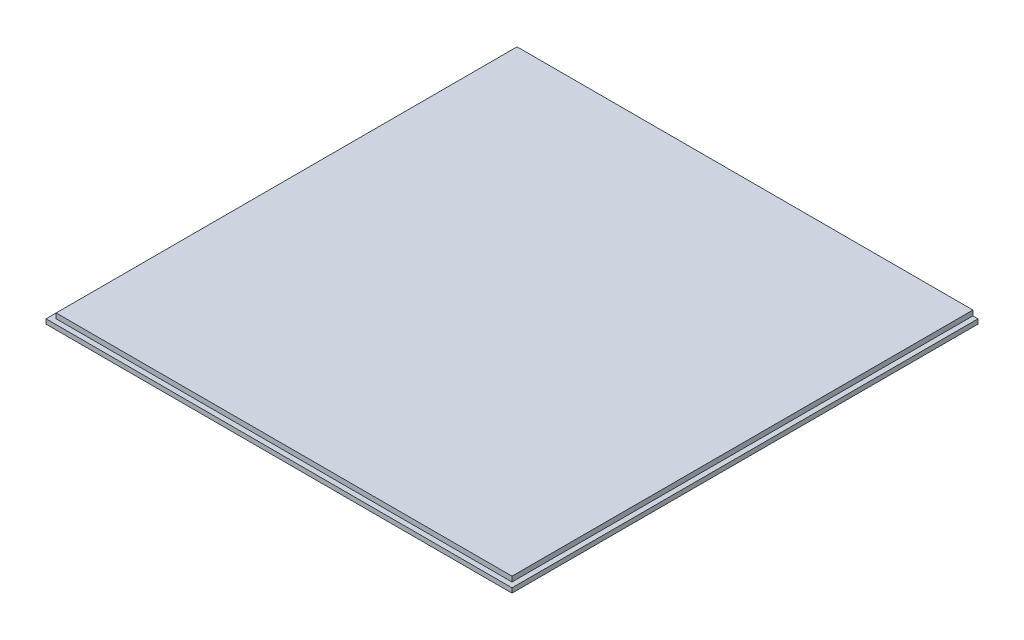
from build123d import *

# Parameters (mm, degrees)
SKETCH1_W           = 877.8875
SKETCH1_H           = 877.8875
BOSS_EXTRUDE1_DEPTH = 18.25625
CUT_EXTRUDE1_DEPTH  = 9.525


with BuildPart() as part:
    # Sketch1 → Boss-Extrude1 (new body)
    with BuildSketch(Plane(origin=(0, 0, 0), x_dir=(1, 0, 0), z_dir=(0, 1, 0))):
        Rectangle(SKETCH1_W, SKETCH1_H)
    extrude(amount=BOSS_EXTRUDE1_DEPTH)

    # Sketch3 → Cut-Extrude1 (cut)
    with BuildSketch(Plane(origin=(0, 18.25625, 0), x_dir=(1, 0, 0), z_dir=(0, 1, 0))):
        Polygon((429.41875, 438.94375), (438.94375, 438.94375), (438.94375, -438.94375), (-438.94375, -438.94375), (-438.94375, 438.94375), (-429.41875, 438.94375), (-429.41875, -429.41875), (429.41875, -429.41875), align=None)
    extrude(amount=-CUT_EXTRUDE1_DEPTH, mode=Mode.SUBTRACT)


solid = part.part
